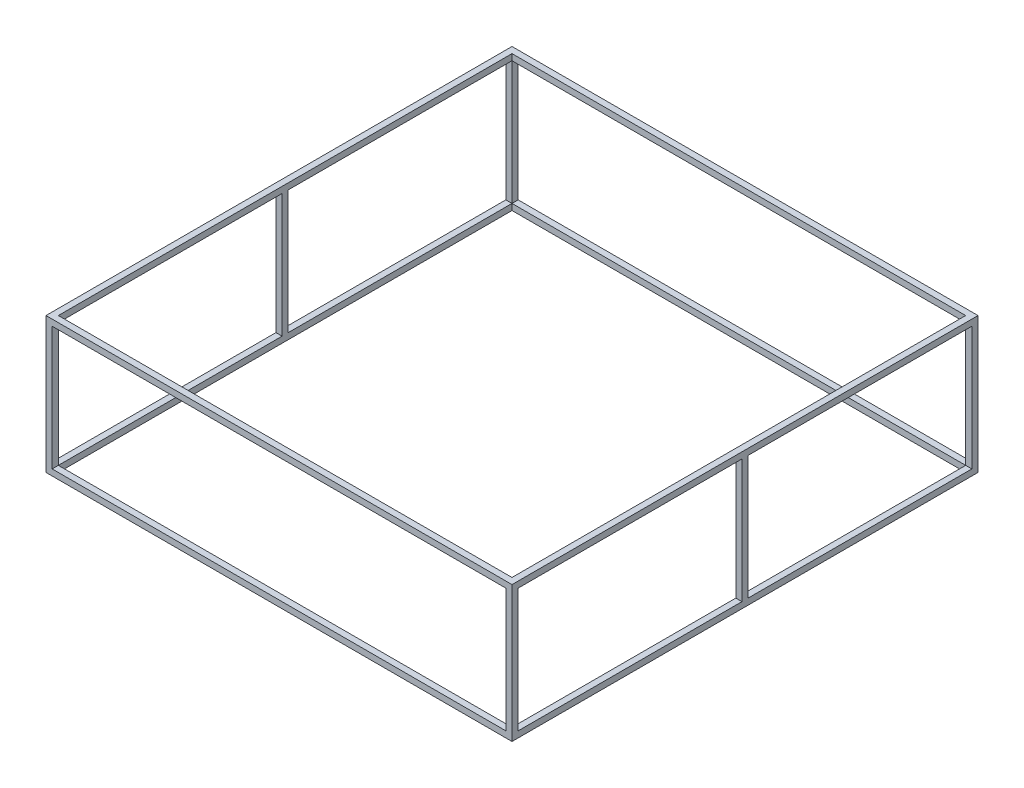
from build123d import *

# Parameters (mm, degrees)
SKETCH1_W           = 1200
SKETCH1_H           = 1200
SKETCH1_W_2         = 1168.25
SKETCH1_H_2         = 1168.25
BOSS_EXTRUDE1_DEPTH = 15.875
SKETCH2_W           = 15.875
SKETCH2_H           = 15.875
BOSS_EXTRUDE2_DEPTH = 318.25
SKETCH3_W           = 1200
SKETCH3_H           = 1200
SKETCH3_W_2         = 1168.25
SKETCH3_H_2         = 1168.25
BOSS_EXTRUDE3_DEPTH = 15.875


with BuildPart() as part:
    # Sketch1 → Boss-Extrude1 (new body)
    with BuildSketch(Plane(origin=(0, 0, 0), x_dir=(1, 0, 0), z_dir=(0, 1, 0))):
        Rectangle(SKETCH1_W, SKETCH1_H)
        Rectangle(SKETCH1_W_2, SKETCH1_H_2, mode=Mode.SUBTRACT)
    extrude(amount=BOSS_EXTRUDE1_DEPTH)

    # Sketch2 → Boss-Extrude2 (add)
    with BuildSketch(Plane(origin=(0, 15.875, 0), x_dir=(1, 0, 0), z_dir=(0, 1, 0))):
        with Locations((-592.0625, 592.0625)):
            Rectangle(SKETCH2_W, SKETCH2_H)
        with Locations((-592.0625, -592.0625)):
            Rectangle(SKETCH2_W, SKETCH2_H)
        with Locations((-592.0625, 0)):
            Rectangle(SKETCH2_W, SKETCH2_H)
    boss_extrude2 = extrude(amount=BOSS_EXTRUDE2_DEPTH)

    # Sketch3 → Boss-Extrude3 (add)
    with BuildSketch(Plane(origin=(0, 334.125, 0), x_dir=(1, 0, 0), z_dir=(0, 1, 0))):
        Rectangle(SKETCH3_W, SKETCH3_H)
        Rectangle(SKETCH3_W_2, SKETCH3_H_2, mode=Mode.SUBTRACT)
    extrude(amount=BOSS_EXTRUDE3_DEPTH)

    # Mirror1: Boss-Extrude2 across plane
    add(boss_extrude2.mirror(Plane(origin=(0, 0, 0), x_dir=(0, 0, 1), z_dir=(1, 0, 0))))


solid = part.part
